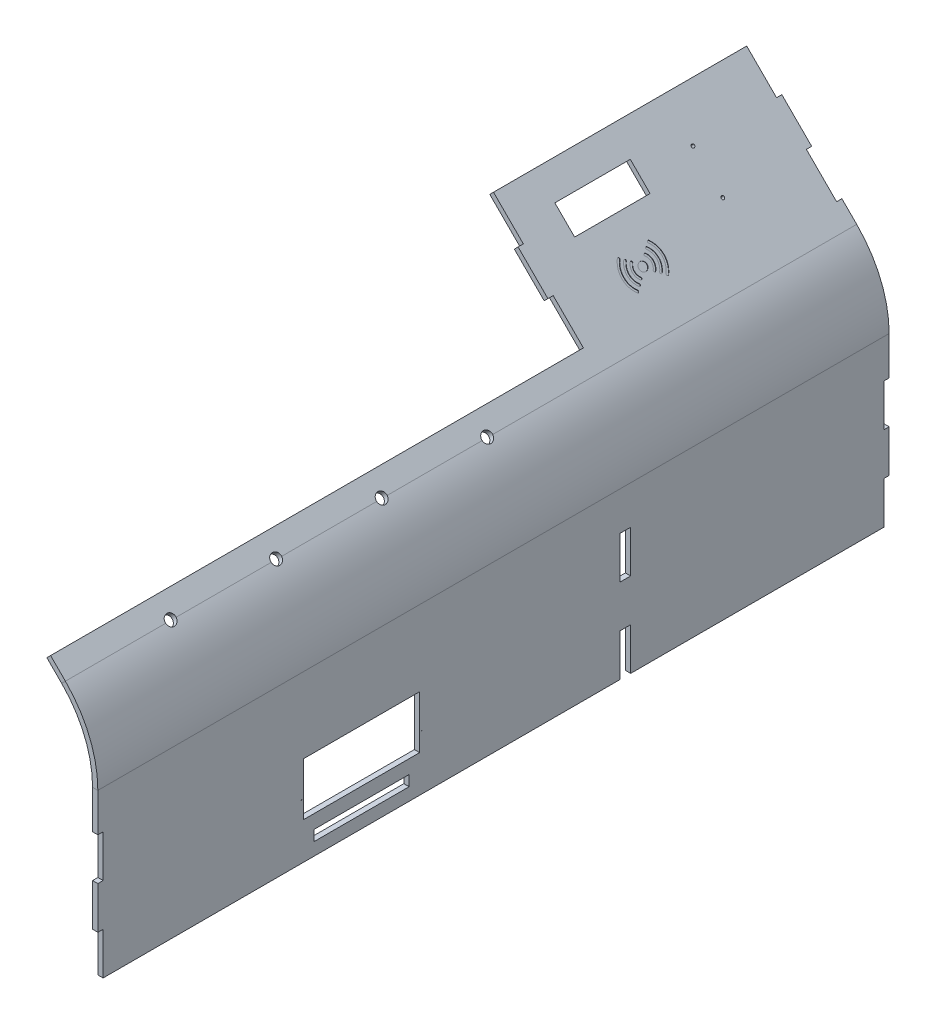
from build123d import *

# Parameters (mm, degrees)
T_LE_DE_BASE_PLI_E1_DEPTH       = 750
ESQUISSE8_W                     = 110
ESQUISSE8_H                     = 50
ESQUISSE8_W_2                   = 5
ESQUISSE8_H_2                   = 40
ESQUISSE8_W_3                   = 90
ESQUISSE8_H_3                   = 10
ENL_V_MAT_EXTRU_3_DEPTH         = 10
ESQUISSE9_W                     = 5
ESQUISSE9_H                     = 40
ESQUISSE9_H_2                   = 40.5
ESQUISSE9_W_2                   = 71.5
ESQUISSE9_H_3                   = 26.5
ESQUISSE9_R                     = 1.5
ENL_V_MAT_EXTRU_4_DEPTH         = 10
ENL_V_MAT_EXTRU_5_REACH         = 819.089
ESQUISSE12_W                    = 500
ESQUISSE12_H                    = 120.5
ESQUISSE12_R                    = 5
DIAM_TRE_DU_PER_AGE_0_7_0_7_1_D = 0.7
ESQUISSE17_R                    = 3.9
ENL_V_MAT_EXTRU_7_DEPTH         = 0.5


# Sheet-metal steps are written as plain solids
with BuildPart() as part:
    # Esquisse1 → Tôle de base pliée1 (new body)
    with BuildSketch(Plane.XY):
        with BuildLine():
            Line((0, 0), (0, 156.498643763))
            ThreePointArc((0, 156.498643763), (-7.612046749, 194.766986999), (-29.289321881, 227.209321881))
            Line((-29.289321881, 227.209321881), (-128.54, 326.46))
            Line((-128.54, 326.46), (-125.004466094, 329.995533906))
            Line((-125.004466094, 329.995533906), (-25.753787975, 230.744855787))
            ThreePointArc((-25.753787975, 230.744855787), (-2.992649086, 196.680404161), (5, 156.498643763))
            Line((5, 156.498643763), (5, 0))
            Line((5, 0), (0, 0))
        make_face()
    extrude(amount=-T_LE_DE_BASE_PLI_E1_DEPTH)

    # Esquisse8 → Enlèv. mat.-Extru.3 (cut)
    with BuildSketch(Plane(origin=(5, 0, 0), x_dir=(0, 0, -1), z_dir=(1, 0, 0))):
        with Locations((250, 60)):
            Rectangle(ESQUISSE8_W, ESQUISSE8_H)
        with Locations((502.5, 100)):
            Rectangle(ESQUISSE8_W_2, ESQUISSE8_H_2)
        with Locations((497.5, 100)):
            Rectangle(ESQUISSE8_W_2, ESQUISSE8_H_2)
        with Locations((497.5, 20)):
            Rectangle(ESQUISSE8_W_2, ESQUISSE8_H_2)
        with Locations((502.5, 20)):
            Rectangle(ESQUISSE8_W_2, ESQUISSE8_H_2)
        with Locations((747.5, 100)):
            Rectangle(ESQUISSE8_W_2, ESQUISSE8_H_2)
        with Locations((747.5, 20)):
            Rectangle(ESQUISSE8_W_2, ESQUISSE8_H_2)
        with Locations((2.5, 100)):
            Rectangle(ESQUISSE8_W_2, ESQUISSE8_H_2)
        with Locations((2.5, 20)):
            Rectangle(ESQUISSE8_W_2, ESQUISSE8_H_2)
        with Locations((250, 17)):
            Rectangle(ESQUISSE8_W_3, ESQUISSE8_H_3)
    extrude(amount=-ENL_V_MAT_EXTRU_3_DEPTH, mode=Mode.SUBTRACT)

    # Esquisse9 → Enlèv. mat.-Extru.4 (cut)
    with BuildSketch(Plane(origin=(102.495533906, 102.495533906, 0), x_dir=(0, 0, -1), z_dir=(0.7071067811865456, 0.7071067811865496, 0))):
        with Locations((502.5, 301.73358544)):
            Rectangle(ESQUISSE9_W, ESQUISSE9_H)
        with Locations((747.5, 301.73358544)):
            Rectangle(ESQUISSE9_W, ESQUISSE9_H)
        with Locations((502.5, 221.48358544)):
            Rectangle(ESQUISSE9_W, ESQUISSE9_H_2)
        with Locations((747.5, 221.48358544)):
            Rectangle(ESQUISSE9_W, ESQUISSE9_H_2)
        with Locations((580, 281.73358544)):
            Rectangle(ESQUISSE9_W_2, ESQUISSE9_H_3)
        with Locations(Location((665.75, 281.73358544, 0), (0, 0, 90))):
            Circle(ESQUISSE9_R)
        with Locations(Location((665.75, 241.73358544, 0), (0, 0, 90))):
            Circle(ESQUISSE9_R)
    extrude(amount=-ENL_V_MAT_EXTRU_4_DEPTH, mode=Mode.SUBTRACT)

    # Esquisse12 → Enlèv. mat.-Extru.5 (cut, up to next)
    with BuildSketch(Plane(origin=(102.495533906, 102.495533906, 0), x_dir=(0, 0, -1), z_dir=(0.7071067811865456, 0.7071067811865496, 0)), mode=Mode.PRIVATE) as enl_v_mat_extru_5_sk1:
        with Locations((250, 261.48358544)):
            Rectangle(ESQUISSE12_W, ESQUISSE12_H)
    enl_v_mat_extru_5_tool1 = extrude(enl_v_mat_extru_5_sk1.sketch, amount=-ENL_V_MAT_EXTRU_5_REACH, mode=Mode.PRIVATE) & part.part
    # Esquisse12 → Enlèv. mat.-Extru.5 (cut, up to next)
    with BuildSketch(Plane(origin=(102.495533906, 102.495533906, 0), x_dir=(0, 0, -1), z_dir=(0.7071067811865456, 0.7071067811865496, 0)), mode=Mode.PRIVATE) as enl_v_mat_extru_5_sk2:
        with Locations(Location((100, 181.73358544, 0), (0, 0, 184.147884007))):
            Circle(ESQUISSE12_R)
    enl_v_mat_extru_5_tool2 = extrude(enl_v_mat_extru_5_sk2.sketch, amount=-ENL_V_MAT_EXTRU_5_REACH, mode=Mode.PRIVATE) & part.part
    # Esquisse12 → Enlèv. mat.-Extru.5 (cut, up to next)
    with BuildSketch(Plane(origin=(102.495533906, 102.495533906, 0), x_dir=(0, 0, -1), z_dir=(0.7071067811865456, 0.7071067811865496, 0)), mode=Mode.PRIVATE) as enl_v_mat_extru_5_sk3:
        with Locations(Location((200, 181.73358544, 0), (0, 0, 184.147884007))):
            Circle(ESQUISSE12_R)
    enl_v_mat_extru_5_tool3 = extrude(enl_v_mat_extru_5_sk3.sketch, amount=-ENL_V_MAT_EXTRU_5_REACH, mode=Mode.PRIVATE) & part.part
    # Esquisse12 → Enlèv. mat.-Extru.5 (cut, up to next)
    with BuildSketch(Plane(origin=(102.495533906, 102.495533906, 0), x_dir=(0, 0, -1), z_dir=(0.7071067811865456, 0.7071067811865496, 0)), mode=Mode.PRIVATE) as enl_v_mat_extru_5_sk4:
        with Locations(Location((300, 181.73358544, 0), (0, 0, 184.147884007))):
            Circle(ESQUISSE12_R)
    enl_v_mat_extru_5_tool4 = extrude(enl_v_mat_extru_5_sk4.sketch, amount=-ENL_V_MAT_EXTRU_5_REACH, mode=Mode.PRIVATE) & part.part
    # Esquisse12 → Enlèv. mat.-Extru.5 (cut, up to next)
    with BuildSketch(Plane(origin=(102.495533906, 102.495533906, 0), x_dir=(0, 0, -1), z_dir=(0.7071067811865456, 0.7071067811865496, 0)), mode=Mode.PRIVATE) as enl_v_mat_extru_5_sk5:
        with Locations(Location((400, 181.73358544, 0), (0, 0, 184.147884007))):
            Circle(ESQUISSE12_R)
    enl_v_mat_extru_5_tool5 = extrude(enl_v_mat_extru_5_sk5.sketch, amount=-ENL_V_MAT_EXTRU_5_REACH, mode=Mode.PRIVATE) & part.part
    add(enl_v_mat_extru_5_tool1.solids().sort_by_distance((-82.401283, 287.39235, -250))[0], mode=Mode.SUBTRACT)
    add(enl_v_mat_extru_5_tool2.solids().sort_by_distance((-26.009517, 231.000585, -100))[0], mode=Mode.SUBTRACT)
    add(enl_v_mat_extru_5_tool3.solids().sort_by_distance((-26.009517, 231.000585, -200))[0], mode=Mode.SUBTRACT)
    add(enl_v_mat_extru_5_tool4.solids().sort_by_distance((-26.009517, 231.000585, -300))[0], mode=Mode.SUBTRACT)
    add(enl_v_mat_extru_5_tool5.solids().sort_by_distance((-26.009517, 231.000585, -400))[0], mode=Mode.SUBTRACT)

    # Diamètre du perçage Ø0.7 (0.7)1 (through all)
    with Locations(Plane(origin=(5, 52, -193), x_dir=(0, 0, 1), z_dir=(1, 0, 0))):
        with Locations((0, 0), (-114, 0)):
            Hole(DIAM_TRE_DU_PER_AGE_0_7_0_7_1_D / 2)

    # Esquisse17 → Enlèv. mat.-Extru.7 (cut)
    with BuildSketch(Plane(origin=(102.495533906, 102.495533906, 0), x_dir=(0, 0, -1), z_dir=(0.7071067811865454, 0.7071067811865498, 0))):
        with Locations(Location((580.75, 228.48358544, 0), (0, 0, 90))):
            Circle(ESQUISSE17_R)
        with BuildLine():
            Line((567.18599727, 241.880395207), (567.201324671, 241.867533991))
            ThreePointArc((567.201324671, 241.867533991), (567.55235105, 241.181043411), (567.304469135, 240.450945205))
            ThreePointArc((567.304469135, 240.450945205), (562.75, 228.48358544), (567.304469135, 216.516225675))
            ThreePointArc((567.304469135, 216.516225675), (567.55235105, 215.786127468), (567.201324671, 215.099636889))
            Line((567.201324671, 215.099636889), (567.18599727, 215.086775673))
            ThreePointArc((567.18599727, 215.086775673), (566.477728964, 214.857774662), (565.810113137, 215.186977583))
            ThreePointArc((565.810113137, 215.186977583), (560.75, 228.48358544), (565.810113137, 241.780193297))
            ThreePointArc((565.810113137, 241.780193297), (566.477728964, 242.109396218), (567.18599727, 241.880395207))
        make_face()
        with BuildLine():
            Line((594.31400273, 215.086775673), (594.298675329, 215.099636889))
            ThreePointArc((594.298675329, 215.099636889), (593.94764895, 215.786127468), (594.195530865, 216.516225675))
            ThreePointArc((594.195530865, 216.516225675), (598.75, 228.48358544), (594.195530865, 240.450945205))
            ThreePointArc((594.195530865, 240.450945205), (593.94764895, 241.181043411), (594.298675329, 241.867533991))
            Line((594.298675329, 241.867533991), (594.31400273, 241.880395207))
            ThreePointArc((594.31400273, 241.880395207), (595.022271036, 242.109396218), (595.689886863, 241.780193297))
            ThreePointArc((595.689886863, 241.780193297), (600.75, 228.48358544), (595.689886863, 215.186977583))
            ThreePointArc((595.689886863, 215.186977583), (595.022271036, 214.857774662), (594.31400273, 215.086775673))
        make_face()
        with BuildLine():
            Line((571.018426643, 238.664605133), (571.033759532, 238.651739312))
            ThreePointArc((571.033759532, 238.651739312), (571.385147358, 237.960099295), (571.129999813, 237.227474529))
            ThreePointArc((571.129999813, 237.227474529), (567.75, 228.48358544), (571.129999813, 219.739696351))
            ThreePointArc((571.129999813, 219.739696351), (571.385147358, 219.007071585), (571.033759532, 218.315431568))
            Line((571.033759532, 218.315431568), (571.018426643, 218.302565746))
            ThreePointArc((571.018426643, 218.302565746), (570.315294999, 218.073204073), (569.64942924, 218.395110392))
            ThreePointArc((569.64942924, 218.395110392), (565.75, 228.48358544), (569.64942924, 238.572060488))
            ThreePointArc((569.64942924, 238.572060488), (570.315294999, 238.893966806), (571.018426643, 238.664605133))
        make_face()
        with BuildLine():
            Line((574.853310602, 235.446755418), (574.868660577, 235.43387526))
            ThreePointArc((574.868660577, 235.43387526), (575.220724048, 234.731344358), (574.950045244, 233.993623991))
            ThreePointArc((574.950045244, 233.993623991), (572.75, 228.48358544), (574.950045244, 222.973546889))
            ThreePointArc((574.950045244, 222.973546889), (575.220724048, 222.235826522), (574.868660577, 221.53329562))
            Line((574.868660577, 221.53329562), (574.853310602, 221.520415462))
            ThreePointArc((574.853310602, 221.520415462), (574.161030067, 221.290380084), (573.499113062, 221.597030524))
            ThreePointArc((573.499113062, 221.597030524), (570.75, 228.48358544), (573.499113062, 235.370140356))
            ThreePointArc((573.499113062, 235.370140356), (574.161030067, 235.676790796), (574.853310602, 235.446755418))
        make_face()
        with BuildLine():
            Line((586.646689398, 221.520415462), (586.631339423, 221.53329562))
            ThreePointArc((586.631339423, 221.53329562), (586.279275952, 222.235826522), (586.549954756, 222.973546889))
            ThreePointArc((586.549954756, 222.973546889), (588.75, 228.48358544), (586.549954756, 233.993623991))
            ThreePointArc((586.549954756, 233.993623991), (586.279275952, 234.731344358), (586.631339423, 235.43387526))
            Line((586.631339423, 235.43387526), (586.646689398, 235.446755418))
            ThreePointArc((586.646689398, 235.446755418), (587.338969933, 235.676790796), (588.000886938, 235.370140356))
            ThreePointArc((588.000886938, 235.370140356), (590.75, 228.48358544), (588.000886938, 221.597030524))
            ThreePointArc((588.000886938, 221.597030524), (587.338969933, 221.290380084), (586.646689398, 221.520415462))
        make_face()
        with BuildLine():
            Line((590.481573357, 218.302565746), (590.466240468, 218.315431568))
            ThreePointArc((590.466240468, 218.315431568), (590.114852642, 219.007071585), (590.370000187, 219.739696351))
            ThreePointArc((590.370000187, 219.739696351), (593.75, 228.48358544), (590.370000187, 237.227474529))
            ThreePointArc((590.370000187, 237.227474529), (590.114852642, 237.960099295), (590.466240468, 238.651739312))
            Line((590.466240468, 238.651739312), (590.481573357, 238.664605133))
            ThreePointArc((590.481573357, 238.664605133), (591.184705001, 238.893966806), (591.85057076, 238.572060488))
            ThreePointArc((591.85057076, 238.572060488), (595.75, 228.48358544), (591.85057076, 218.395110392))
            ThreePointArc((591.85057076, 218.395110392), (591.184705001, 218.073204073), (590.481573357, 218.302565746))
        make_face()
    extrude(amount=-ENL_V_MAT_EXTRU_7_DEPTH, mode=Mode.SUBTRACT)


solid = part.part
